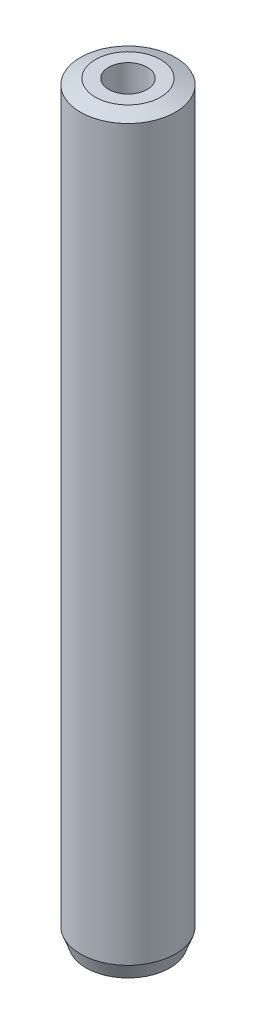
from build123d import *
from OCP.BRepFilletAPI import BRepFilletAPI_MakeChamfer

# Parameters (mm, degrees)
SKETCH1_R           = 12.5
BOSS_EXTRUDE1_DEPTH = 197.237292432
SKETCH2_R           = 5.068994309
CUT_EXTRUDE1_DEPTH  = 199.027900878
CHAMFER1_SIZE       = 1.467325787
CHAMFER1_SIZE2      = 3.922382174


with BuildPart() as part:
    # Sketch1 → Boss-Extrude1 (new body)
    with BuildSketch(Plane(origin=(0, 0, 0), x_dir=(1, 0, 0), z_dir=(0, 1, 0))):
        Circle(SKETCH1_R)
    extrude(amount=BOSS_EXTRUDE1_DEPTH)

    # Sketch2 → Cut-Extrude1 (cut, through all)
    with BuildSketch(Plane(origin=(0, 0, 0), x_dir=(1, 0, 0), z_dir=(0, 1, 0))):
        Circle(SKETCH2_R)
    extrude(amount=CUT_EXTRUDE1_DEPTH, mode=Mode.SUBTRACT)

    # Chamfer1: one chamfer whose edges measure the first distance from different faces: ONE call of the kernel's chamfer builder (chamfer() names one face for all edges)
    chamfer1_edges_1 = [part.edges().sort_by_distance(p)[0] for p in [
        (-12.5, 197.237292432, 0),
    ]]
    chamfer1_side_1 = [part.faces().sort_by_distance(p)[0] for p in [
        (-12.5, 98.618646216, 0),
    ]]
    chamfer1_edges_2 = [part.edges().sort_by_distance(p)[0] for p in [
        (-12.5, 0, 0),
    ]]
    chamfer1_side_2 = [part.faces().sort_by_distance(p)[0] for p in [
        (-12.146446609, 0, 0),
    ]]
    chamfer1 = BRepFilletAPI_MakeChamfer(part.part.solid().wrapped)
    for e in chamfer1_edges_1:
        chamfer1.Add(CHAMFER1_SIZE, CHAMFER1_SIZE2, e.wrapped, chamfer1_side_1[0].wrapped)  # the first distance lies on this face
    for e in chamfer1_edges_2:
        chamfer1.Add(CHAMFER1_SIZE, CHAMFER1_SIZE2, e.wrapped, chamfer1_side_2[0].wrapped)  # the first distance lies on this face
    add(Compound.cast(chamfer1.Shape()), mode=Mode.REPLACE)


solid = part.part
